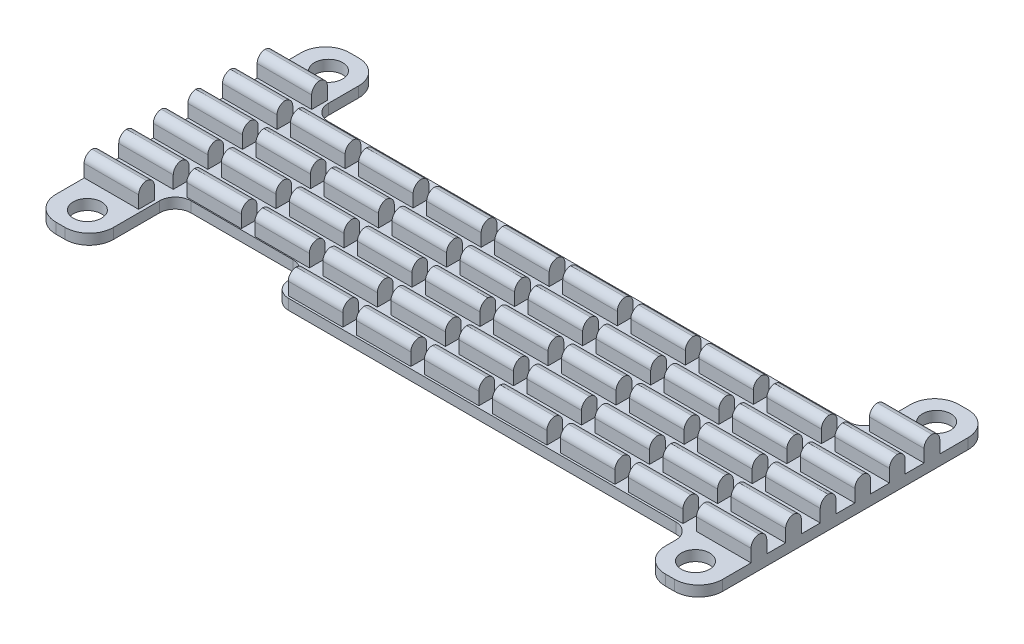
from build123d import *

# Parameters (mm, degrees)
SZKIC1_W                         = 63.6
SZKIC1_H                         = 28
SZKIC1_R                         = 1.35
DODANIE_WYCI_GNI_CIE1_DEPTH      = 1
SZKIC4_W                         = 1.5
SZKIC4_H                         = 2
DODANIE_WYCI_GNI_CIE2_DEPTH      = 5.2
ZAOKR_GLENIE3_R                  = 0.8
SZYK_LINIOWY1_COUNT              = 6
SZYK_LINIOWY1_PITCH              = 3.3
SZYK_LINIOWY1_COUNT_DIR2         = 10
SZYK_LINIOWY1_PITCH_DIR2         = 6.49
ZAOKR_GLENIE3_OF_SZYK_LINIOWY1_R = 0.8
SZKIC2_W                         = 52.64
SZKIC2_H                         = 6.7
WYTNIJ_WYCI_GNI_CIE1_DEPTH       = 35.88361676
ZAOKR_GLENIE1_R                  = 2.3
ZAOKR_GLENIE2_R                  = 1.5


with BuildPart() as part:
    # Szkic1 → Dodanie-wyciągnięcie1 (new body)
    with BuildSketch(Plane(origin=(0, 0, 0), x_dir=(1, 0, 0), z_dir=(0, 1, 0))):
        Rectangle(SZKIC1_W, SZKIC1_H)
        with Locations(Location((-29, 11.5, 0), (0, 0, 270))):
            Circle(SZKIC1_R, mode=Mode.SUBTRACT)
        with Locations(Location((29, 11.5, 0), (0, 0, 270))):
            Circle(SZKIC1_R, mode=Mode.SUBTRACT)
        with Locations(Location((29, -11.5, 0), (0, 0, 90))):
            Circle(SZKIC1_R, mode=Mode.SUBTRACT)
        with Locations(Location((-29, -11.5, 0), (0, 0, 90))):
            Circle(SZKIC1_R, mode=Mode.SUBTRACT)
    extrude(amount=DODANIE_WYCI_GNI_CIE1_DEPTH)

    # Szkic4 → Dodanie-wyciągnięcie2 (add)
    with BuildSketch(Plane(origin=(31.8, 0, 0), x_dir=(0, 0, -1), z_dir=(1, 0, 0))):
        with Locations((8.25, 2)):
            Rectangle(SZKIC4_W, SZKIC4_H)
    dodanie_wyci_gni_cie2 = extrude(amount=-DODANIE_WYCI_GNI_CIE2_DEPTH)

    # Zaokrąglenie3
    # the kernel refuses this fillet: 0.8 mm, written as the material it takes off along each edge
    with BuildSketch(Plane(origin=(33.8, 3, -7.5), x_dir=(0, -1, 0), z_dir=(-1, 0, 0))) as zaokr_glenie3_piece_1:
        with BuildLine():
            CenterArc((ZAOKR_GLENIE3_R, -ZAOKR_GLENIE3_R), ZAOKR_GLENIE3_R, 90, 90)
            Line((0, -ZAOKR_GLENIE3_R), (0, 0))
            Line((0, 0), (ZAOKR_GLENIE3_R, 0))
        make_face()
    extrude(amount=9.2, mode=Mode.SUBTRACT)
    with BuildSketch(Plane(origin=(33.8, 3, -9), x_dir=(0, -1, 0), z_dir=(-1, 0, 0))) as zaokr_glenie3_piece_2:
        with BuildLine():
            CenterArc((ZAOKR_GLENIE3_R, ZAOKR_GLENIE3_R), ZAOKR_GLENIE3_R, 180, 90)
            Line((0, ZAOKR_GLENIE3_R), (0, 0))
            Line((0, 0), (ZAOKR_GLENIE3_R, 0))
        make_face()
    extrude(amount=9.2, mode=Mode.SUBTRACT)

    # Szyk liniowy1: Dodanie-wyci_gni_cie2 6 × 10
    with Locations(*[(-j * SZYK_LINIOWY1_PITCH_DIR2, 0, i * SZYK_LINIOWY1_PITCH) for i in range(SZYK_LINIOWY1_COUNT) for j in range(SZYK_LINIOWY1_COUNT_DIR2) if (i, j) != (0, 0)]):
        add(dodanie_wyci_gni_cie2)

    # Zaokrąglenie3 of Szyk liniowy1
    # the kernel refuses this fillet: 0.8 mm, written as the material it takes off along each edge
    with BuildSketch(Plane(origin=(27.31, 3, -7.5), x_dir=(0, -1, 0), z_dir=(-1, 0, 0)), Plane(origin=(20.82, 3, -7.5), x_dir=(0, -1, 0), z_dir=(-1, 0, 0)), Plane(origin=(14.33, 3, -7.5), x_dir=(0, -1, 0), z_dir=(-1, 0, 0)), Plane(origin=(7.84, 3, -7.5), x_dir=(0, -1, 0), z_dir=(-1, 0, 0)), Plane(origin=(1.35, 3, -7.5), x_dir=(0, -1, 0), z_dir=(-1, 0, 0)), Plane(origin=(-5.14, 3, -7.5), x_dir=(0, -1, 0), z_dir=(-1, 0, 0)), Plane(origin=(-11.63, 3, -7.5), x_dir=(0, -1, 0), z_dir=(-1, 0, 0)), Plane(origin=(-18.12, 3, -7.5), x_dir=(0, -1, 0), z_dir=(-1, 0, 0)), Plane(origin=(-24.61, 3, -7.5), x_dir=(0, -1, 0), z_dir=(-1, 0, 0)), Plane(origin=(33.8, 3, -4.2), x_dir=(0, -1, 0), z_dir=(-1, 0, 0)), Plane(origin=(33.8, 3, -5.7), x_dir=(0, 0, 1), z_dir=(-1, 0, 0)), Plane(origin=(27.31, 3, -4.2), x_dir=(0, -1, 0), z_dir=(-1, 0, 0)), Plane(origin=(20.82, 3, -4.2), x_dir=(0, -1, 0), z_dir=(-1, 0, 0)), Plane(origin=(14.33, 3, -4.2), x_dir=(0, -1, 0), z_dir=(-1, 0, 0)), Plane(origin=(7.84, 3, -4.2), x_dir=(0, -1, 0), z_dir=(-1, 0, 0)), Plane(origin=(1.35, 3, -4.2), x_dir=(0, -1, 0), z_dir=(-1, 0, 0)), Plane(origin=(-5.14, 3, -4.2), x_dir=(0, -1, 0), z_dir=(-1, 0, 0)), Plane(origin=(-11.63, 3, -4.2), x_dir=(0, -1, 0), z_dir=(-1, 0, 0)), Plane(origin=(-18.12, 3, -4.2), x_dir=(0, -1, 0), z_dir=(-1, 0, 0)), Plane(origin=(-24.61, 3, -4.2), x_dir=(0, -1, 0), z_dir=(-1, 0, 0)), Plane(origin=(33.8, 3, -0.9), x_dir=(0, -1, 0), z_dir=(-1, 0, 0)), Plane(origin=(33.8, 3, -2.4), x_dir=(0, 0, 1), z_dir=(-1, 0, 0)), Plane(origin=(27.31, 3, -0.9), x_dir=(0, -1, 0), z_dir=(-1, 0, 0)), Plane(origin=(20.82, 3, -0.9), x_dir=(0, -1, 0), z_dir=(-1, 0, 0)), Plane(origin=(14.33, 3, -0.9), x_dir=(0, -1, 0), z_dir=(-1, 0, 0)), Plane(origin=(7.84, 3, -0.9), x_dir=(0, -1, 0), z_dir=(-1, 0, 0)), Plane(origin=(1.35, 3, -0.9), x_dir=(0, -1, 0), z_dir=(-1, 0, 0)), Plane(origin=(-5.14, 3, -0.9), x_dir=(0, -1, 0), z_dir=(-1, 0, 0)), Plane(origin=(-11.63, 3, -0.9), x_dir=(0, -1, 0), z_dir=(-1, 0, 0)), Plane(origin=(-18.12, 3, -0.9), x_dir=(0, -1, 0), z_dir=(-1, 0, 0)), Plane(origin=(-24.61, 3, -0.9), x_dir=(0, -1, 0), z_dir=(-1, 0, 0)), Plane(origin=(33.8, 3, 2.4), x_dir=(0, -1, 0), z_dir=(-1, 0, 0)), Plane(origin=(33.8, 3, 0.9), x_dir=(0, 0, 1), z_dir=(-1, 0, 0)), Plane(origin=(27.31, 3, 2.4), x_dir=(0, -1, 0), z_dir=(-1, 0, 0)), Plane(origin=(20.82, 3, 2.4), x_dir=(0, -1, 0), z_dir=(-1, 0, 0)), Plane(origin=(14.33, 3, 2.4), x_dir=(0, -1, 0), z_dir=(-1, 0, 0)), Plane(origin=(7.84, 3, 2.4), x_dir=(0, -1, 0), z_dir=(-1, 0, 0)), Plane(origin=(1.35, 3, 2.4), x_dir=(0, -1, 0), z_dir=(-1, 0, 0)), Plane(origin=(-5.14, 3, 2.4), x_dir=(0, -1, 0), z_dir=(-1, 0, 0)), Plane(origin=(-11.63, 3, 2.4), x_dir=(0, -1, 0), z_dir=(-1, 0, 0)), Plane(origin=(-18.12, 3, 2.4), x_dir=(0, -1, 0), z_dir=(-1, 0, 0)), Plane(origin=(-24.61, 3, 2.4), x_dir=(0, -1, 0), z_dir=(-1, 0, 0)), Plane(origin=(33.8, 3, 5.7), x_dir=(0, -1, 0), z_dir=(-1, 0, 0)), Plane(origin=(33.8, 3, 4.2), x_dir=(0, 0, 1), z_dir=(-1, 0, 0)), Plane(origin=(27.31, 3, 5.7), x_dir=(0, -1, 0), z_dir=(-1, 0, 0)), Plane(origin=(20.82, 3, 5.7), x_dir=(0, -1, 0), z_dir=(-1, 0, 0)), Plane(origin=(14.33, 3, 5.7), x_dir=(0, -1, 0), z_dir=(-1, 0, 0)), Plane(origin=(7.84, 3, 5.7), x_dir=(0, -1, 0), z_dir=(-1, 0, 0)), Plane(origin=(1.35, 3, 5.7), x_dir=(0, -1, 0), z_dir=(-1, 0, 0)), Plane(origin=(-5.14, 3, 5.7), x_dir=(0, -1, 0), z_dir=(-1, 0, 0)), Plane(origin=(-11.63, 3, 5.7), x_dir=(0, -1, 0), z_dir=(-1, 0, 0)), Plane(origin=(-18.12, 3, 5.7), x_dir=(0, -1, 0), z_dir=(-1, 0, 0)), Plane(origin=(-24.61, 3, 5.7), x_dir=(0, -1, 0), z_dir=(-1, 0, 0)), Plane(origin=(33.8, 3, 9), x_dir=(0, -1, 0), z_dir=(-1, 0, 0)), Plane(origin=(33.8, 3, 7.5), x_dir=(0, 0, 1), z_dir=(-1, 0, 0)), Plane(origin=(27.31, 3, 9), x_dir=(0, -1, 0), z_dir=(-1, 0, 0)), Plane(origin=(20.82, 3, 9), x_dir=(0, -1, 0), z_dir=(-1, 0, 0)), Plane(origin=(14.33, 3, 9), x_dir=(0, -1, 0), z_dir=(-1, 0, 0)), Plane(origin=(7.84, 3, 9), x_dir=(0, -1, 0), z_dir=(-1, 0, 0)), Plane(origin=(1.35, 3, 9), x_dir=(0, -1, 0), z_dir=(-1, 0, 0)), Plane(origin=(-5.14, 3, 9), x_dir=(0, -1, 0), z_dir=(-1, 0, 0)), Plane(origin=(-11.63, 3, 9), x_dir=(0, -1, 0), z_dir=(-1, 0, 0)), Plane(origin=(-18.12, 3, 9), x_dir=(0, -1, 0), z_dir=(-1, 0, 0)), Plane(origin=(-24.61, 3, 9), x_dir=(0, -1, 0), z_dir=(-1, 0, 0))) as zaokr_glenie3_of_szyk_liniowy1_piece_1:
        with BuildLine():
            CenterArc((ZAOKR_GLENIE3_OF_SZYK_LINIOWY1_R, -ZAOKR_GLENIE3_OF_SZYK_LINIOWY1_R), ZAOKR_GLENIE3_OF_SZYK_LINIOWY1_R, 90, 90)
            Line((0, -ZAOKR_GLENIE3_OF_SZYK_LINIOWY1_R), (0, 0))
            Line((0, 0), (ZAOKR_GLENIE3_OF_SZYK_LINIOWY1_R, 0))
        make_face()
    extrude(amount=9.2, mode=Mode.SUBTRACT)
    with BuildSketch(Plane(origin=(27.31, 3, -9), x_dir=(0, -1, 0), z_dir=(-1, 0, 0)), Plane(origin=(20.82, 3, -9), x_dir=(0, -1, 0), z_dir=(-1, 0, 0)), Plane(origin=(14.33, 3, -9), x_dir=(0, -1, 0), z_dir=(-1, 0, 0)), Plane(origin=(7.84, 3, -9), x_dir=(0, -1, 0), z_dir=(-1, 0, 0)), Plane(origin=(1.35, 3, -9), x_dir=(0, -1, 0), z_dir=(-1, 0, 0)), Plane(origin=(-5.14, 3, -9), x_dir=(0, -1, 0), z_dir=(-1, 0, 0)), Plane(origin=(-11.63, 3, -9), x_dir=(0, -1, 0), z_dir=(-1, 0, 0)), Plane(origin=(-18.12, 3, -9), x_dir=(0, -1, 0), z_dir=(-1, 0, 0)), Plane(origin=(-24.61, 3, -9), x_dir=(0, -1, 0), z_dir=(-1, 0, 0)), Plane(origin=(27.31, 3, -5.7), x_dir=(0, -1, 0), z_dir=(-1, 0, 0)), Plane(origin=(20.82, 3, -5.7), x_dir=(0, -1, 0), z_dir=(-1, 0, 0)), Plane(origin=(14.33, 3, -5.7), x_dir=(0, -1, 0), z_dir=(-1, 0, 0)), Plane(origin=(7.84, 3, -5.7), x_dir=(0, -1, 0), z_dir=(-1, 0, 0)), Plane(origin=(1.35, 3, -5.7), x_dir=(0, -1, 0), z_dir=(-1, 0, 0)), Plane(origin=(-5.14, 3, -5.7), x_dir=(0, -1, 0), z_dir=(-1, 0, 0)), Plane(origin=(-11.63, 3, -5.7), x_dir=(0, -1, 0), z_dir=(-1, 0, 0)), Plane(origin=(-18.12, 3, -5.7), x_dir=(0, -1, 0), z_dir=(-1, 0, 0)), Plane(origin=(-24.61, 3, -5.7), x_dir=(0, -1, 0), z_dir=(-1, 0, 0)), Plane(origin=(27.31, 3, -2.4), x_dir=(0, -1, 0), z_dir=(-1, 0, 0)), Plane(origin=(20.82, 3, -2.4), x_dir=(0, -1, 0), z_dir=(-1, 0, 0)), Plane(origin=(14.33, 3, -2.4), x_dir=(0, -1, 0), z_dir=(-1, 0, 0)), Plane(origin=(7.84, 3, -2.4), x_dir=(0, -1, 0), z_dir=(-1, 0, 0)), Plane(origin=(1.35, 3, -2.4), x_dir=(0, -1, 0), z_dir=(-1, 0, 0)), Plane(origin=(-5.14, 3, -2.4), x_dir=(0, -1, 0), z_dir=(-1, 0, 0)), Plane(origin=(-11.63, 3, -2.4), x_dir=(0, -1, 0), z_dir=(-1, 0, 0)), Plane(origin=(-18.12, 3, -2.4), x_dir=(0, -1, 0), z_dir=(-1, 0, 0)), Plane(origin=(-24.61, 3, -2.4), x_dir=(0, -1, 0), z_dir=(-1, 0, 0)), Plane(origin=(27.31, 3, 0.9), x_dir=(0, -1, 0), z_dir=(-1, 0, 0)), Plane(origin=(20.82, 3, 0.9), x_dir=(0, -1, 0), z_dir=(-1, 0, 0)), Plane(origin=(14.33, 3, 0.9), x_dir=(0, -1, 0), z_dir=(-1, 0, 0)), Plane(origin=(7.84, 3, 0.9), x_dir=(0, -1, 0), z_dir=(-1, 0, 0)), Plane(origin=(1.35, 3, 0.9), x_dir=(0, -1, 0), z_dir=(-1, 0, 0)), Plane(origin=(-5.14, 3, 0.9), x_dir=(0, -1, 0), z_dir=(-1, 0, 0)), Plane(origin=(-11.63, 3, 0.9), x_dir=(0, -1, 0), z_dir=(-1, 0, 0)), Plane(origin=(-18.12, 3, 0.9), x_dir=(0, -1, 0), z_dir=(-1, 0, 0)), Plane(origin=(-24.61, 3, 0.9), x_dir=(0, -1, 0), z_dir=(-1, 0, 0)), Plane(origin=(27.31, 3, 4.2), x_dir=(0, -1, 0), z_dir=(-1, 0, 0)), Plane(origin=(20.82, 3, 4.2), x_dir=(0, -1, 0), z_dir=(-1, 0, 0)), Plane(origin=(14.33, 3, 4.2), x_dir=(0, -1, 0), z_dir=(-1, 0, 0)), Plane(origin=(7.84, 3, 4.2), x_dir=(0, -1, 0), z_dir=(-1, 0, 0)), Plane(origin=(1.35, 3, 4.2), x_dir=(0, -1, 0), z_dir=(-1, 0, 0)), Plane(origin=(-5.14, 3, 4.2), x_dir=(0, -1, 0), z_dir=(-1, 0, 0)), Plane(origin=(-11.63, 3, 4.2), x_dir=(0, -1, 0), z_dir=(-1, 0, 0)), Plane(origin=(-18.12, 3, 4.2), x_dir=(0, -1, 0), z_dir=(-1, 0, 0)), Plane(origin=(-24.61, 3, 4.2), x_dir=(0, -1, 0), z_dir=(-1, 0, 0)), Plane(origin=(27.31, 3, 7.5), x_dir=(0, -1, 0), z_dir=(-1, 0, 0)), Plane(origin=(20.82, 3, 7.5), x_dir=(0, -1, 0), z_dir=(-1, 0, 0)), Plane(origin=(14.33, 3, 7.5), x_dir=(0, -1, 0), z_dir=(-1, 0, 0)), Plane(origin=(7.84, 3, 7.5), x_dir=(0, -1, 0), z_dir=(-1, 0, 0)), Plane(origin=(1.35, 3, 7.5), x_dir=(0, -1, 0), z_dir=(-1, 0, 0)), Plane(origin=(-5.14, 3, 7.5), x_dir=(0, -1, 0), z_dir=(-1, 0, 0)), Plane(origin=(-11.63, 3, 7.5), x_dir=(0, -1, 0), z_dir=(-1, 0, 0)), Plane(origin=(-18.12, 3, 7.5), x_dir=(0, -1, 0), z_dir=(-1, 0, 0)), Plane(origin=(-24.61, 3, 7.5), x_dir=(0, -1, 0), z_dir=(-1, 0, 0))) as zaokr_glenie3_of_szyk_liniowy1_piece_2:
        with BuildLine():
            CenterArc((ZAOKR_GLENIE3_OF_SZYK_LINIOWY1_R, ZAOKR_GLENIE3_OF_SZYK_LINIOWY1_R), ZAOKR_GLENIE3_OF_SZYK_LINIOWY1_R, 180, 90)
            Line((0, ZAOKR_GLENIE3_OF_SZYK_LINIOWY1_R), (0, 0))
            Line((0, 0), (ZAOKR_GLENIE3_OF_SZYK_LINIOWY1_R, 0))
        make_face()
    extrude(amount=9.2, mode=Mode.SUBTRACT)

    # Szkic2 → Wytnij-wyciągnięcie1 (cut, through all)
    with BuildSketch(Plane(origin=(0, 0, 0), x_dir=(1, 0, 0), z_dir=(0, 1, 0))):
        with Locations((0, 10.65)):
            Rectangle(SZKIC2_W, SZKIC2_H)
        Polygon((-13.6, -5.8), (-26.32, -5.8), (-26.32, -14), (26.32, -14), (26.32, -9.2), (-13.6, -9.2), align=None)
    extrude(amount=WYTNIJ_WYCI_GNI_CIE1_DEPTH, mode=Mode.SUBTRACT)

    # Zaokrąglenie1
    zaokr_glenie1_edges = [part.edges().sort_by_distance(p)[0] for p in [
        (-26.32, 0.5, 14),
        (26.32, 0.5, 14),
        (26.32, 0.5, -14),
        (-26.32, 0.5, -14),
        (31.8, 0.5, 14),
        (-31.8, 0.5, 14),
        (-31.8, 0.5, -14),
        (31.8, 0.5, -14),
    ]]
    fillet(zaokr_glenie1_edges, radius=ZAOKR_GLENIE1_R)

    # Zaokrąglenie2
    zaokr_glenie2_edges = [part.edges().sort_by_distance(p)[0] for p in [
        (-26.32, 0.5, -7.3),
        (26.32, 0.5, -7.3),
        (26.32, 0.5, 9.2),
        (-13.6, 0.5, 9.2),
        (-13.6, 0.5, 5.8),
        (-26.32, 0.5, 5.8),
    ]]
    fillet(zaokr_glenie2_edges, radius=ZAOKR_GLENIE2_R)


solid = part.part
